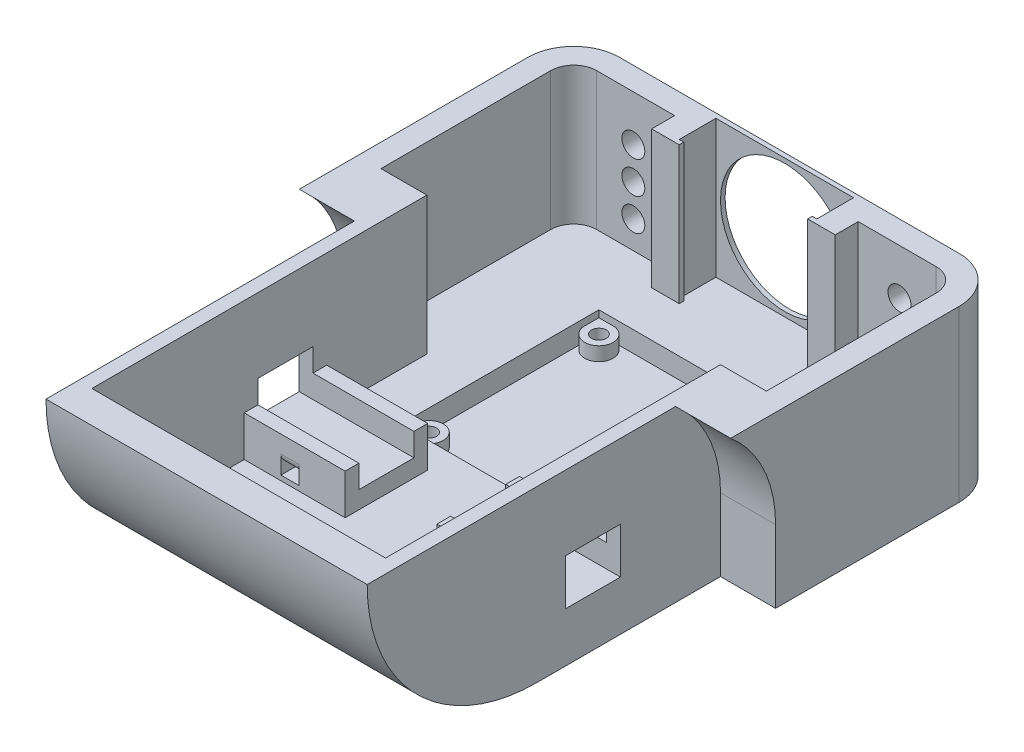
from build123d import *

# Parameters (mm, degrees)
BOSS_EXTRUDE1_DEPTH             = 7
SKETCH1_5_W                     = 43.2
SKETCH1_5_H                     = 43.2
CUT_EXTRUDE1_DEPTH              = 1.5
CUT_EXTRUDE2_START              = -1.5
SKETCH1_6_R                     = 1.6
CUT_EXTRUDE2_DEPTH              = 3
BOSS_EXTRUDE2_START             = 30
BOSS_EXTRUDE2_DEPTH             = 30
BOSS_EXTRUDE3_REACH             = 75.9
BOSS_EXTRUDE3_DIRECTION_2_REACH = 75.9
SKETCH6_W                       = 43.38
SKETCH6_H                       = 21.02
CUT_EXTRUDE3_DEPTH              = 9
CUT_EXTRUDE4_START              = 9
SKETCH6_3_R                     = 1.5
CUT_EXTRUDE4_DEPTH              = 3
BOSS_EXTRUDE4_DEPTH             = 30
BOSS_EXTRUDE6_REACH             = 107.873
SKETCH8_W                       = 3
SKETCH8_H                       = 30
SKETCH9_R                       = 2.5
CUT_EXTRUDE5_DEPTH              = 5
CUT_EXTRUDE6_DEPTH              = 103.074727528
CUT_EXTRUDE6_DEPTH_BACK         = 103.074727528
SKETCH10_W                      = 12
SKETCH10_H                      = 10
BOSS_EXTRUDE7_START             = 10
BOSS_EXTRUDE7_DEPTH             = 22
BOSS_EXTRUDE8_START             = -10
BOSS_EXTRUDE8_DEPTH             = 22
BOSS_EXTRUDE9_START             = -35
BOSS_EXTRUDE9_DEPTH             = 12
BOSS_EXTRUDE10_START            = 47
BOSS_EXTRUDE10_DEPTH            = 12
BOSS_EXTRUDE11_DEPTH            = 5
CHAMFER1_SIZE                   = 5
BOSS_EXTRUDE12_DEPTH            = 1
SKETCH14_W                      = 4
SKETCH14_H                      = 2
CUT_EXTRUDE7_DEPTH              = 18
FILLET1_R                       = 2


with BuildPart() as part:
    # Sketch1 → Boss-Extrude1 (new body)
    with BuildSketch(Plane(origin=(0, 0, 0), x_dir=(1, 0, 0), z_dir=(0, 1, 0))):
        with BuildLine():
            Line((-35, -8.5), (-35, -48.5))
            Line((-35, -48.5), (35, -48.5))
            Line((35, -48.5), (35, -8.5))
            Line((35, -8.5), (47, -8.5))
            Line((47, -8.5), (47, 31.5))
            ThreePointArc((47, 31.5), (44.071067812, 38.571067812), (37, 41.5))
            Line((37, 41.5), (-37, 41.5))
            ThreePointArc((-37, 41.5), (-44.071067812, 38.571067812), (-47, 31.5))
            Line((-47, 31.5), (-47, -8.5))
            Line((-47, -8.5), (-35, -8.5))
        make_face()
    extrude(amount=-BOSS_EXTRUDE1_DEPTH)

    # Sketch1<5> → Cut-Extrude1 (cut)
    with BuildSketch(Plane(origin=(0, 0, 0), x_dir=(1, 0, 0), z_dir=(0, 1, 0))):
        Rectangle(SKETCH1_5_W, SKETCH1_5_H)
    extrude(amount=-CUT_EXTRUDE1_DEPTH, mode=Mode.SUBTRACT)

    # Sketch1<6> → Cut-Extrude2 (cut)
    with BuildSketch(Plane(origin=(0, 0, 0), x_dir=(1, 0, 0), z_dir=(0, 1, 0)).offset(CUT_EXTRUDE2_START)):
        with BuildLine():
            ThreePointArc((-17.718975032, 21.5), (-16.307968978, 16.307968978), (-21.5, 17.718975032))
            Line((-21.5, 17.718975032), (-21.6, 17.718975032))
            Line((-21.6, 17.718975032), (-21.6, -17.718975032))
            Line((-21.6, -17.718975032), (-21.5, -17.718975032))
            ThreePointArc((-21.5, -17.718975032), (-16.307968978, -16.307968978), (-17.718975032, -21.5))
            Line((-17.718975032, -21.5), (-17.718975032, -21.6))
            Line((-17.718975032, -21.6), (17.718975032, -21.6))
            Line((17.718975032, -21.6), (17.718975032, -21.5))
            ThreePointArc((17.718975032, -21.5), (16.307968978, -16.307968978), (21.5, -17.718975032))
            Line((21.5, -17.718975032), (21.6, -17.718975032))
            Line((21.6, -17.718975032), (21.6, 17.718975032))
            Line((21.6, 17.718975032), (21.5, 17.718975032))
            ThreePointArc((21.5, 17.718975032), (16.307968978, 16.307968978), (17.718975032, 21.5))
            Line((17.718975032, 21.5), (17.718975032, 21.6))
            Line((17.718975032, 21.6), (-17.718975032, 21.6))
            Line((-17.718975032, 21.6), (-17.718975032, 21.5))
        make_face()
        with Locations(Location((-18.5, 18.5, 0), (0, 0, 270))):
            Circle(SKETCH1_6_R)
        with Locations(Location((18.5, 18.5, 0), (0, 0, 270))):
            Circle(SKETCH1_6_R)
        with Locations(Location((-18.5, -18.5, 0), (0, 0, 270))):
            Circle(SKETCH1_6_R)
        with Locations(Location((18.5, -18.5, 0), (0, 0, 270))):
            Circle(SKETCH1_6_R)
    extrude(amount=-CUT_EXTRUDE2_DEPTH, mode=Mode.SUBTRACT)

    # Sketch3 → Boss-Extrude2 (add)
    with BuildSketch(Plane(origin=(0, 0, 0), x_dir=(1, 0, 0), z_dir=(0, 1, 0)).offset(BOSS_EXTRUDE2_START)):
        with BuildLine():
            Line((42, -8.5), (47, -8.5))
            Line((47, -8.5), (47, 31.5))
            ThreePointArc((47, 31.5), (44.071067812, 38.571067812), (37, 41.5))
            Line((37, 41.5), (14, 41.5))
            Line((14, 41.5), (14, 40.5))
            Line((14, 40.5), (15, 40.5))
            Line((15, 40.5), (15, 32.5))
            Line((15, 32.5), (14, 32.5))
            Line((14, 32.5), (14, 31.5))
            Line((14, 31.5), (20, 31.5))
            Line((20, 31.5), (20, 36.5))
            Line((20, 36.5), (37, 36.5))
            ThreePointArc((37, 36.5), (40.535533906, 35.035533906), (42, 31.5))
            Line((42, 31.5), (42, -8.5))
        make_face()
        with BuildLine():
            Line((-14, 40.5), (-14, 41.5))
            Line((-14, 41.5), (-37, 41.5))
            ThreePointArc((-37, 41.5), (-44.071067812, 38.571067812), (-47, 31.5))
            Line((-47, 31.5), (-47, -8.5))
            Line((-47, -8.5), (-42, -8.5))
            Line((-42, -8.5), (-42, 31.5))
            ThreePointArc((-42, 31.5), (-40.535533906, 35.035533906), (-37, 36.5))
            Line((-37, 36.5), (-20, 36.5))
            Line((-20, 36.5), (-20, 31.5))
            Line((-20, 31.5), (-14, 31.5))
            Line((-14, 31.5), (-14, 32.5))
            Line((-14, 32.5), (-15, 32.5))
            Line((-15, 32.5), (-15, 40.5))
            Line((-15, 40.5), (-14, 40.5))
        make_face()
    extrude(amount=-BOSS_EXTRUDE2_DEPTH)

    # Boss-Extrude3: up to this face of the body (flat: up to its plane)
    boss_extrude3_end = Plane(part.part.faces().sort_by_distance((-35, -3.5, 28.5))[0])
    # Sketch5 → Boss-Extrude3 (add, up to the picked face)
    with BuildSketch(Plane(origin=(0, 0, 0), x_dir=(0, 0, -1), z_dir=(1, 0, 0)), mode=Mode.PRIVATE) as boss_extrude3_sk1:
        with BuildLine():
            Line((-48.5, 0), (-48.5, -7))
            ThreePointArc((-48.5, -7), (-74.662950904, 3.837049096), (-85.5, 30))
            Line((-85.5, 30), (-78.5, 30))
            ThreePointArc((-78.5, 30), (-69.713203436, 8.786796564), (-48.5, 0))
        make_face()
    boss_extrude3_tool1 = split(extrude(boss_extrude3_sk1.sketch, amount=-BOSS_EXTRUDE3_REACH, mode=Mode.PRIVATE), bisect_by=boss_extrude3_end, keep=Keep.BOTH, mode=Mode.PRIVATE)
    add(boss_extrude3_tool1.solids().sort_by(Axis((0, 8.59564, 69.90436), (-1, 0, 0)))[0])

    # Boss-Extrude3 direction 2: up to this face of the body (flat: up to its plane)
    boss_extrude3_direction_2_end = Plane(part.part.faces().sort_by_distance((35, -3.5, 28.5))[0])
    # Sketch5 → Boss-Extrude3 direction 2 (add, up to the picked face)
    with BuildSketch(Plane(origin=(0, 0, 0), x_dir=(0, 0, -1), z_dir=(1, 0, 0)), mode=Mode.PRIVATE) as boss_extrude3_direction_2_sk1:
        with BuildLine():
            Line((-48.5, 0), (-48.5, -7))
            ThreePointArc((-48.5, -7), (-74.662950904, 3.837049096), (-85.5, 30))
            Line((-85.5, 30), (-78.5, 30))
            ThreePointArc((-78.5, 30), (-69.713203436, 8.786796564), (-48.5, 0))
        make_face()
    boss_extrude3_direction_2_tool1 = split(extrude(boss_extrude3_direction_2_sk1.sketch, amount=BOSS_EXTRUDE3_DIRECTION_2_REACH, mode=Mode.PRIVATE), bisect_by=boss_extrude3_direction_2_end, keep=Keep.BOTH, mode=Mode.PRIVATE)
    add(boss_extrude3_direction_2_tool1.solids().sort_by(Axis((0, 8.59564, 69.90436), (1, 0, 0)))[0])

    # Sketch6 → Cut-Extrude3 (cut)
    with BuildSketch(Plane(origin=(0, -24.25, 24.25), x_dir=(-1, 0, 0), z_dir=(0, -0.7071067811865477, 0.7071067811865474))):
        with Locations((0, -55.507882323)):
            Rectangle(SKETCH6_W, SKETCH6_H)
    extrude(amount=CUT_EXTRUDE3_DEPTH, mode=Mode.SUBTRACT)

    # Sketch6<3> → Cut-Extrude4 (cut)
    with BuildSketch(Plane(origin=(0, -24.25, 24.25), x_dir=(-1, 0, 0), z_dir=(0, -0.7071067811865477, 0.7071067811865474)).offset(CUT_EXTRUDE4_START)):
        with BuildLine():
            Line((-21.69, -64.417882323), (-17.818427125, -64.417882323))
            ThreePointArc((-17.818427125, -64.417882323), (-14.99, -60.417882323), (-12.161572875, -64.417882323))
            Line((-12.161572875, -64.417882323), (21.69, -64.417882323))
            Line((21.69, -64.417882323), (21.69, -46.597882323))
            Line((21.69, -46.597882323), (17.818427125, -46.597882323))
            ThreePointArc((17.818427125, -46.597882323), (14.99, -50.597882323), (12.161572875, -46.597882323))
            Line((12.161572875, -46.597882323), (-21.69, -46.597882323))
            Line((-21.69, -46.597882323), (-21.69, -64.417882323))
        make_face()
        with Locations(Location((-14.99, -63.417882323, 0), (0, 0, 90))):
            Circle(SKETCH6_3_R)
        with Locations(Location((14.99, -47.597882323, 0), (0, 0, 90))):
            Circle(SKETCH6_3_R)
    extrude(amount=CUT_EXTRUDE4_DEPTH, mode=Mode.SUBTRACT)

    # Sketch7 → Boss-Extrude4 (add)
    with BuildSketch(Plane(origin=(0, 0, 0), x_dir=(1, 0, 0), z_dir=(0, 1, 0))):
        Polygon((35, -48.5), (35, -8.5), (42, -8.5), (42, -5.5), (32, -5.5), (32, -48.5), align=None)
        Polygon((-42, -8.5), (-35, -8.5), (-35, -48.5), (-32, -48.5), (-32, -5.5), (-42, -5.5), align=None)
    extrude(amount=BOSS_EXTRUDE4_DEPTH)

    # Sketch8 → Boss-Extrude6 (add, up to next)
    with BuildSketch(Plane.XY.offset(48.5), mode=Mode.PRIVATE) as boss_extrude6_sk1:
        with Locations((33.5, 15)):
            Rectangle(SKETCH8_W, SKETCH8_H)
    boss_extrude6_tool1 = extrude(boss_extrude6_sk1.sketch, amount=BOSS_EXTRUDE6_REACH, mode=Mode.PRIVATE) - part.part
    # Sketch8 → Boss-Extrude6 (add, up to next)
    with BuildSketch(Plane.XY.offset(48.5), mode=Mode.PRIVATE) as boss_extrude6_sk2:
        with Locations((-33.5, 15)):
            Rectangle(SKETCH8_W, SKETCH8_H)
    boss_extrude6_tool2 = extrude(boss_extrude6_sk2.sketch, amount=BOSS_EXTRUDE6_REACH, mode=Mode.PRIVATE) - part.part
    add(boss_extrude6_tool1.solids().sort_by_distance((33.5, 15, 48.5))[0])
    add(boss_extrude6_tool2.solids().sort_by_distance((-33.5, 15, 48.5))[0])

    # Sketch9 → Cut-Extrude5 (cut)
    with BuildSketch(Plane(origin=(0, 0, -41.5), x_dir=(-1, 0, 0), z_dir=(0, 0, -1))):
        with Locations((-29, 20)):
            Circle(SKETCH9_R)
        with Locations((-29, 13)):
            Circle(SKETCH9_R)
        with Locations((-29, 6)):
            Circle(SKETCH9_R)
        with Locations((29, 20)):
            Circle(SKETCH9_R)
        with Locations((29, 13)):
            Circle(SKETCH9_R)
        with Locations((29, 6)):
            Circle(SKETCH9_R)
    extrude(amount=-CUT_EXTRUDE5_DEPTH, mode=Mode.SUBTRACT)

    # Sketch10 → Cut-Extrude6 (cut, two sides: drawn at the far end of the back side and taken through both)
    with BuildSketch(Plane(origin=(0, 0, 0), x_dir=(0, 0, -1), z_dir=(1, 0, 0)).offset(-CUT_EXTRUDE6_DEPTH_BACK)):
        with Locations((-36.3125, 8.8125)):
            Rectangle(SKETCH10_W, SKETCH10_H)
    extrude(amount=CUT_EXTRUDE6_DEPTH + CUT_EXTRUDE6_DEPTH_BACK, mode=Mode.SUBTRACT)

    # Sketch10<3> → Boss-Extrude7 (add)
    with BuildSketch(Plane(origin=(0, 0, 0), x_dir=(0, 0, -1), z_dir=(1, 0, 0)).offset(BOSS_EXTRUDE7_START)):
        Polygon((-27.3125, 8.8125), (-30.3125, 8.8125), (-30.3125, 3.8125), (-42.3125, 3.8125), (-42.3125, 8.8125), (-45.3125, 8.8125), (-45.3125, 0), (-27.3125, 0), align=None)
    extrude(amount=BOSS_EXTRUDE7_DEPTH)

    # Sketch10<4> → Boss-Extrude8 (add)
    with BuildSketch(Plane(origin=(0, 0, 0), x_dir=(0, 0, -1), z_dir=(1, 0, 0)).offset(BOSS_EXTRUDE8_START)):
        Polygon((-27.3125, 8.8125), (-30.3125, 8.8125), (-30.3125, 3.8125), (-42.3125, 3.8125), (-42.3125, 8.8125), (-45.3125, 8.8125), (-45.3125, 0), (-27.3125, 0), align=None)
    extrude(amount=-BOSS_EXTRUDE8_DEPTH)

    # Sketch10<5> → Boss-Extrude9 (add)
    with BuildSketch(Plane(origin=(0, 0, 0), x_dir=(0, 0, -1), z_dir=(1, 0, 0)).offset(BOSS_EXTRUDE9_START)):
        with BuildLine():
            ThreePointArc((-8.5, 8.8125), (-11.067274912, 20.483565354), (-18.295147253, 30))
            Line((-18.295147253, 30), (-8.5, 30))
            Line((-8.5, 30), (-8.5, 8.8125))
        make_face()
    extrude(amount=-BOSS_EXTRUDE9_DEPTH)

    # Sketch10<6> → Boss-Extrude10 (add)
    with BuildSketch(Plane(origin=(0, 0, 0), x_dir=(0, 0, -1), z_dir=(1, 0, 0)).offset(BOSS_EXTRUDE10_START)):
        with BuildLine():
            ThreePointArc((-8.5, 8.8125), (-11.067274912, 20.483565354), (-18.295147253, 30))
            Line((-18.295147253, 30), (-8.5, 30))
            Line((-8.5, 30), (-8.5, 8.8125))
        make_face()
    extrude(amount=-BOSS_EXTRUDE10_DEPTH)

    # Sketch12 → Boss-Extrude11 (add)
    with BuildSketch(Plane.XZ.offset(7)):
        Polygon((-13.5, -11.303847577), (-22.5, -6.107695155), (-31.5, -11.303847577), (-31.5, -21.696152423), (-22.5, -26.892304845), (-13.5, -21.696152423), align=None)
        Polygon((31.5, -11.303847577), (22.5, -6.107695155), (13.5, -11.303847577), (13.5, -21.696152423), (22.5, -26.892304845), (31.5, -21.696152423), align=None)
    extrude(amount=BOSS_EXTRUDE11_DEPTH)

    # Chamfer1
    chamfer1_edges = [part.edges().sort_by_distance(p)[0] for p in [
        (27, -7, -8.705771366),
        (18, -7, -8.705771366),
        (13.5, -7, -16.5),
        (18, -7, -24.294228634),
        (27, -7, -24.294228634),
        (31.5, -7, -16.5),
        (-18, -7, -8.705771366),
        (-27, -7, -8.705771366),
        (-31.5, -7, -16.5),
        (-27, -7, -24.294228634),
        (-18, -7, -24.294228634),
        (-13.5, -7, -16.5),
    ]]
    chamfer(chamfer1_edges, length=CHAMFER1_SIZE - 0.0001)  # a hair under: the kernel refuses the full size

    # Sketch13 → Boss-Extrude12 (add)
    with BuildSketch(Plane(origin=(0, 0, -41.5), x_dir=(-1, 0, 0), z_dir=(0, 0, -1))):
        with BuildLine():
            Line((14, 30), (-14, 30))
            Line((-14, 30), (-14, 15))
            ThreePointArc((-14, 15), (0, 29), (14, 15))
            Line((14, 15), (14, 30))
        make_face()
        with BuildLine():
            ThreePointArc((14, 15), (0, 1), (-14, 15))
            Line((-14, 15), (-14, 0))
            Line((-14, 0), (14, 0))
            Line((14, 0), (14, 15))
        make_face()
    extrude(amount=-BOSS_EXTRUDE12_DEPTH)

    # Sketch14 → Cut-Extrude7 (cut)
    with BuildSketch(Plane(origin=(0, 0, 27.3125), x_dir=(-1, 0, 0), z_dir=(0, 0, -1))):
        with Locations((-22, 2.0625)):
            Rectangle(SKETCH14_W, SKETCH14_H)
    cut_extrude7 = extrude(amount=-CUT_EXTRUDE7_DEPTH, mode=Mode.SUBTRACT)

    # Mirror2: Cut-Extrude7 across plane
    add(cut_extrude7.mirror(Plane(origin=(0, 0, 0), x_dir=(0, 0, 1), z_dir=(1, 0, 0))), mode=Mode.SUBTRACT)

    # Fillet1
    fillet1_edges = [part.edges().sort_by_distance(p)[0] for p in [
        (22, 3.0625, 27.3125),
        (22, 3.0625, 45.3125),
        (-22, 3.0625, 45.3125),
        (-22, 3.0625, 27.3125),
    ]]
    fillet(fillet1_edges, radius=FILLET1_R)


solid = part.part
